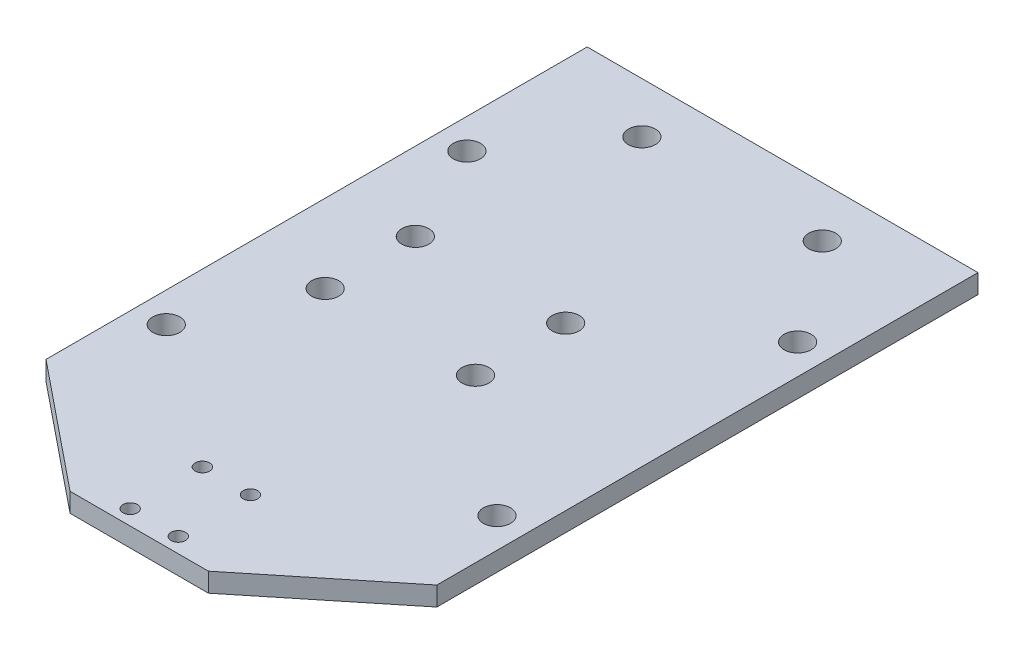
from build123d import *

# Parameters (mm, degrees)
BOSS_EXTRUDE1_DEPTH  = 1.5875
M2_CLEARANCE_HOLE1_D = 2.4
M4_CLEARANCE_HOLE1_D = 4.5
M4_CLEARANCE_HOLE2_D = 4.5
M4_CLEARANCE_HOLE3_D = 4.5


with BuildPart() as part:
    # Sketch1 → Boss-Extrude1 (new, symmetric)
    with BuildSketch(Plane(origin=(0, 0, 0), x_dir=(1, 0, 0), z_dir=(0, 1, 0))):
        Polygon((-32.5, -45), (-11.5, -62), (11.5, -62), (32.5, -45), (32.5, 45), (-32.5, 45), align=None)
    extrude(amount=BOSS_EXTRUDE1_DEPTH, both=True)

    # M2 Clearance Hole1 (through all)
    with Locations(Plane(origin=(0, 1.5875, 0), x_dir=(1, 0, 0), z_dir=(0, 1, 0))):
        with Locations((-4, -59.5), (4, -59.5), (4, -47.5), (-4, -47.5)):
            Hole(M2_CLEARANCE_HOLE1_D / 2)

    # M4 Clearance Hole1 (through all)
    with Locations(Plane(origin=(0, 1.5875, 0), x_dir=(1, 0, 0), z_dir=(0, 1, 0))):
        with Locations((-27.5, 20), (27.5, 20), (27.5, -30), (-27.5, -30)):
            Hole(M4_CLEARANCE_HOLE1_D / 2)

    # M4 Clearance Hole2 (through all)
    with Locations(Plane(origin=(0, 1.5875, 0), x_dir=(1, 0, 0), z_dir=(0, 1, 0))):
        with Locations((-19.5, -11.575), (-19.5, 3.425), (5.5, 3.425), (5.5, -11.575)):
            Hole(M4_CLEARANCE_HOLE2_D / 2)

    # M4 Clearance Hole3 (through all)
    with Locations(Plane(origin=(0, -1.5875, 0), x_dir=(-1, 0, 0), z_dir=(0, -1, 0))):
        with Locations((-15, 36.6), (15, 36.6)):
            Hole(M4_CLEARANCE_HOLE3_D / 2)


solid = part.part
